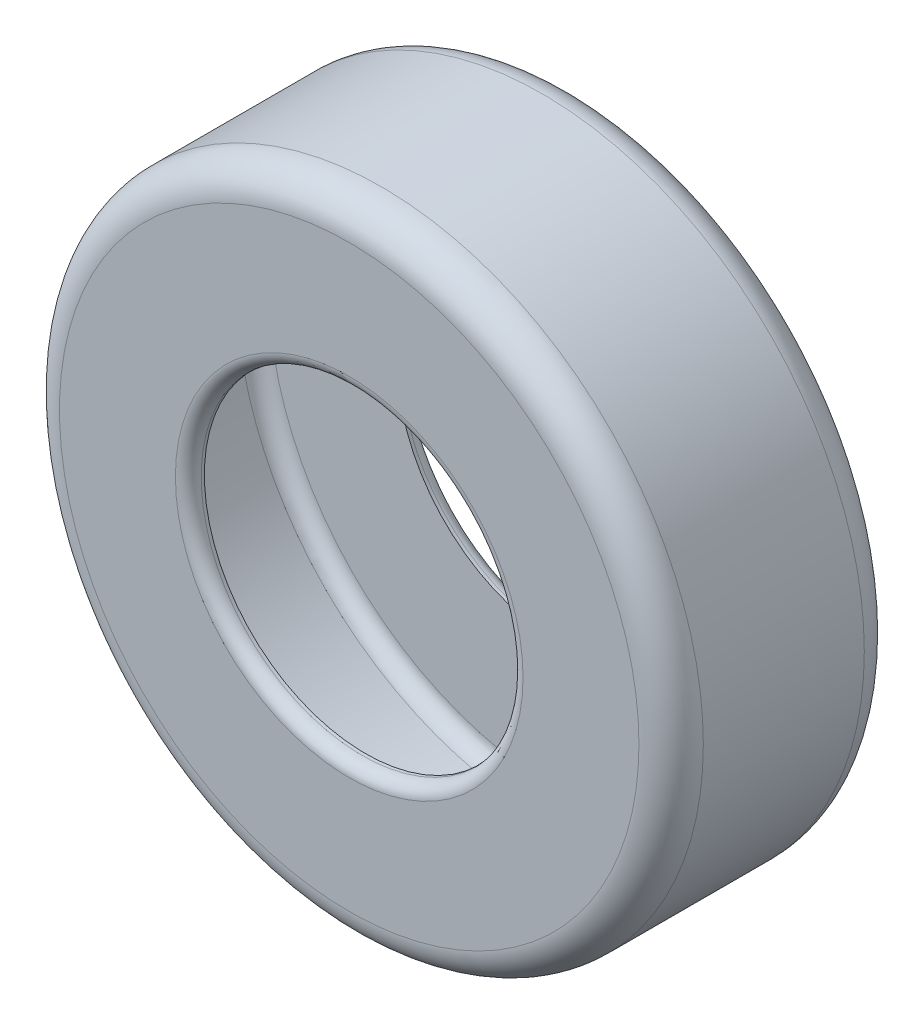
from build123d import *

# Parameters (mm, degrees)
SKETCH3_R           = 25.4
SKETCH3_R_2         = 12.7
EXTRUDE_THIN1_DEPTH = 17.78
FILLET1_R           = 2.54
FILLET2_R           = 1.016


# Read off the part's stored shape, not the designer's step: Shell1
with BuildPart() as part:
    # Sketch3 → Extrude-Thin1 (new body)
    with BuildSketch(Plane.XY):
        Circle(SKETCH3_R)
        Circle(SKETCH3_R_2, mode=Mode.SUBTRACT)
    extrude(amount=EXTRUDE_THIN1_DEPTH)

    # Fillet1
    fillet1_edges = [part.edges().sort_by_distance(p)[0] for p in [
        (-25.4, 0, 0),
        (-25.4, 0, 17.78),
    ]]
    fillet(fillet1_edges, radius=FILLET1_R)

    # Fillet2
    fillet2_edges = [part.edges().sort_by_distance(p)[0] for p in [
        (-12.7, 0, 0),
        (-12.7, 0, 17.78),
    ]]
    fillet(fillet2_edges, radius=FILLET2_R)

    # Shell1 outline → Shell1 (revolve, cut)
    with BuildSketch(Plane.XZ):
        with BuildLine():
            Line((22.86, 16.51), (12.7, 16.51))
            Line((12.7, 16.51), (12.7, 1.27))
            Line((12.7, 1.27), (22.86, 1.27))
            ThreePointArc((22.86, 1.27), (23.758025612, 1.641974388), (24.13, 2.54))
            Line((24.13, 2.54), (24.13, 15.24))
            ThreePointArc((24.13, 15.24), (23.758025612, 16.138025612), (22.86, 16.51))
        make_face()
    revolve(axis=Axis((0, 0, 0), (0, 0, 1)), mode=Mode.SUBTRACT)


solid = part.part
